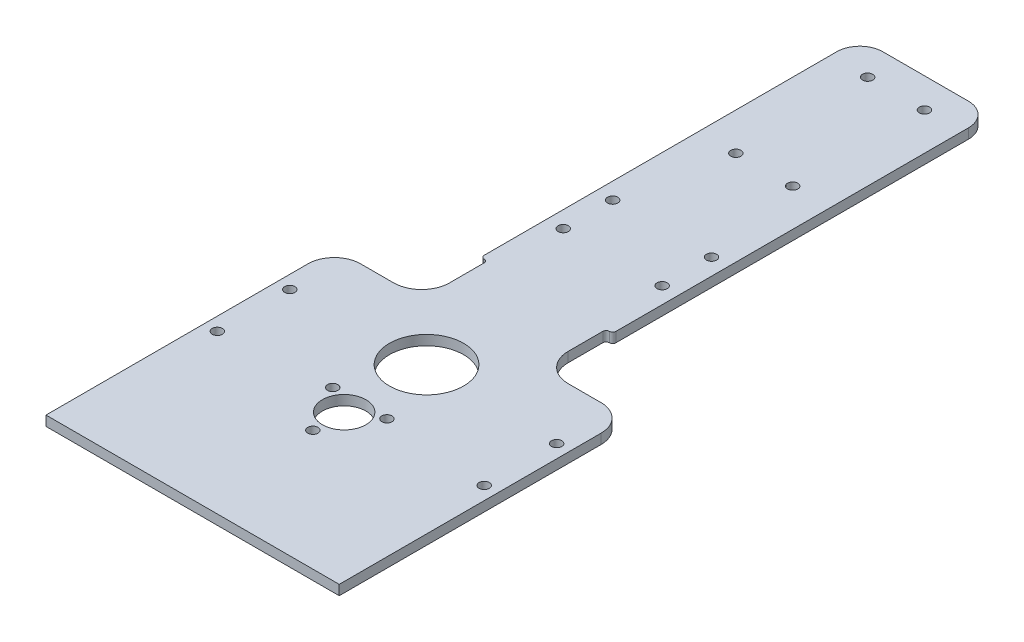
from build123d import *

# Parameters (mm, degrees)
SKETCH_1_W              = 200
SKETCH_1_H              = 200
EXTRUDE_1_DEPTH         = 3
SKETCH_2_R              = 1.5
CUT_EXTRUDE_2_DEPTH     = 10
CUT_EXTRUDE_3_DEPTH     = 10
SKETCH_6_R              = 1.55
CUT_EXTRUDE_3_1_1_DEPTH = 10
CUT_EXTRUDE_6_REACH     = 111.495
SKETCH_11_R             = 1.5
CUT_EXTRUDE_20_5_REACH  = 111.495
SKETCH_4_R              = 11.25
FILLET_1_R              = 1
SKETCH_12_W             = 40
SKETCH_12_H             = 3
EXTRUDE_2_DEPTH         = 75
FILLET_2_R              = 7
SKETCH_13_R             = 1.55
CUT_EXTRUDE_3_1_3_DEPTH = 10
CUT_EXTRUDE_2006_REACH  = 132.367
SKETCH_14_R             = 1.55
SKETCH_14_R_2           = 6.6
FILLET_3_R              = 8
SKETCH_17_R             = 1.55
CUT_EXTRUDE_7_DEPTH     = 131.36679025


with BuildPart() as part:
    # 草图1 → 凸台-拉伸1 (new body)
    with BuildSketch(Plane(origin=(0, 0, 0), x_dir=(1, 0, 0), z_dir=(0, 1, 0))):
        Rectangle(SKETCH_1_W, SKETCH_1_H)
    extrude(amount=EXTRUDE_1_DEPTH)

    # 草图2 → 切除-拉伸2 (cut)
    with BuildSketch(Plane(origin=(0, 3, 0), x_dir=(1, 0, 0), z_dir=(0, 1, 0))):
        with Locations(Location((29.5, 9.5, 0), (0, 0, 270))):
            Circle(SKETCH_2_R)
        with Locations(Location((21.5, 0, 0), (0, 0, 270))):
            Circle(SKETCH_2_R)
        with Locations(Location((29.5, -9.5, 0), (0, 0, 270))):
            Circle(SKETCH_2_R)
        with Locations(Location((37.5, 0, 0), (0, 0, 270))):
            Circle(SKETCH_2_R)
        with Locations(Location((-29.5, -9.5, 0), (0, 0, 270))):
            Circle(SKETCH_2_R)
        with Locations(Location((-37.5, 0, 0), (0, 0, 270))):
            Circle(SKETCH_2_R)
        with Locations(Location((-21.5, 0, 0), (0, 0, 270))):
            Circle(SKETCH_2_R)
        with Locations(Location((-29.5, 9.5, 0), (0, 0, 270))):
            Circle(SKETCH_2_R)
    extrude(amount=-CUT_EXTRUDE_2_DEPTH, mode=Mode.SUBTRACT)

    # 草图5 → 切除-拉伸3 (cut)
    with BuildSketch(Plane(origin=(0, 3, 0), x_dir=(1, 0, 0), z_dir=(0, 1, 0))):
        with BuildLine():
            Line((-100, -100), (-44.5, -100))
            Line((-44.5, -100), (-44.5, 0))
            ThreePointArc((-44.5, 0), (-40.212142643, 10.5), (-29.8, 14.9969997))
            ThreePointArc((-29.8, 14.9969997), (-22.858571571, 17.9949995), (-20, 24.9949995))
            Line((-20, 24.9949995), (-20, 47.5))
            Line((-20, 47.5), (0, 47.5))
            Line((0, 47.5), (20, 47.5))
            Line((20, 47.5), (20, 24.9949995))
            ThreePointArc((20, 24.9949995), (22.858571571, 17.9949995), (29.8, 14.9969997))
            ThreePointArc((29.8, 14.9969997), (40.212142643, 10.5), (44.5, 0))
            Line((44.5, 0), (44.5, -100))
            Line((44.5, -100), (100, -100))
            Line((100, -100), (100, 100))
            Line((100, 100), (-100, 100))
            Line((-100, 100), (-100, -100))
        make_face()
    extrude(amount=-CUT_EXTRUDE_3_DEPTH, mode=Mode.SUBTRACT)

    # 草图6 → φ3.1通孔1 (cut)
    with BuildSketch(Plane.XZ):
        with Locations(Location((-15, -42.5, 0), (0, 0, 270))):
            Circle(SKETCH_6_R)
        with Locations(Location((-15, -27.5, 0), (0, 0, 270))):
            Circle(SKETCH_6_R)
        with Locations(Location((15, -27.5, 0), (0, 0, 90))):
            Circle(SKETCH_6_R)
        with Locations(Location((15, -42.5, 0), (0, 0, 90))):
            Circle(SKETCH_6_R)
    extrude(amount=-CUT_EXTRUDE_3_1_1_DEPTH, mode=Mode.SUBTRACT)

    # 草图11 → 切除-拉伸6 (cut, up to next)
    with BuildSketch(Plane(origin=(0, 3, 0), x_dir=(1, 0, 0), z_dir=(0, 1, 0)), mode=Mode.PRIVATE) as cut_extrude_6_sk1:
        with BuildLine():
            Line((44.5, -17.5), (44.5, -100))
            Line((44.5, -100), (101.133062566, -100))
            Line((101.133062566, -100), (101.133062566, 47.5))
            Line((101.133062566, 47.5), (20, 47.5))
            Line((20, 47.5), (20, 7.5))
            Line((20, 7.5), (19, 7.5))
            ThreePointArc((19, 7.5), (18.292893219, 7.207106781), (18, 6.5))
            Line((18, 6.5), (18, -4))
            ThreePointArc((18, -4), (20.48959236, -10.01040764), (26.5, -12.5))
            Line((26.5, -12.5), (39.5, -12.5))
            Line((39.5, -12.5), (44.5, -12.5))
            Line((44.5, -12.5), (44.5, -17.5))
        make_face()
        with Locations((29.5, -9.5)):
            Circle(SKETCH_11_R, mode=Mode.SUBTRACT)
        with Locations((21.5, 0)):
            Circle(SKETCH_11_R, mode=Mode.SUBTRACT)
    cut_extrude_6_tool1 = extrude(cut_extrude_6_sk1.sketch, amount=-CUT_EXTRUDE_6_REACH, mode=Mode.PRIVATE) & part.part
    # 草图11 → 切除-拉伸6 (cut, up to next)
    with BuildSketch(Plane(origin=(0, 3, 0), x_dir=(1, 0, 0), z_dir=(0, 1, 0)), mode=Mode.PRIVATE) as cut_extrude_6_sk2:
        with BuildLine():
            Line((-44.5, -17.5), (-44.5, -100))
            Line((-44.5, -100), (-101.133062566, -100))
            Line((-101.133062566, -100), (-101.133062566, 47.5))
            Line((-101.133062566, 47.5), (-20, 47.5))
            Line((-20, 47.5), (-20, 7.5))
            Line((-20, 7.5), (-19, 7.5))
            ThreePointArc((-19, 7.5), (-18.292893219, 7.207106781), (-18, 6.5))
            Line((-18, 6.5), (-18, -4))
            ThreePointArc((-18, -4), (-20.48959236, -10.01040764), (-26.5, -12.5))
            Line((-26.5, -12.5), (-39.5, -12.5))
            Line((-39.5, -12.5), (-44.5, -12.5))
            Line((-44.5, -12.5), (-44.5, -17.5))
        make_face()
    cut_extrude_6_tool2 = extrude(cut_extrude_6_sk2.sketch, amount=-CUT_EXTRUDE_6_REACH, mode=Mode.PRIVATE) & part.part
    add(cut_extrude_6_tool1.solids().sort_by_distance((66.686037, 3, 19.669577))[0], mode=Mode.SUBTRACT)
    add(cut_extrude_6_tool2.solids().sort_by_distance((-66.626911, 3, 19.648158))[0], mode=Mode.SUBTRACT)

    # 草图4 → φ20.5落弹孔 (cut, up to next)
    with BuildSketch(Plane(origin=(0, 3, 0), x_dir=(1, 0, 0), z_dir=(0, 1, 0)), mode=Mode.PRIVATE) as cut_extrude_20_5_sk1:
        with Locations(Location((0, -29, 0), (0, 0, 270))):
            Circle(SKETCH_4_R)
    cut_extrude_20_5_tool1 = extrude(cut_extrude_20_5_sk1.sketch, amount=-CUT_EXTRUDE_20_5_REACH, mode=Mode.PRIVATE) & part.part
    add(cut_extrude_20_5_tool1.solids().sort_by_distance((0, 3, 29))[0], mode=Mode.SUBTRACT)

    # 圆角1
    fillet_1_edges = [part.edges().sort_by_distance(p)[0] for p in [
        (-20, 1.5, -7.5),
        (20, 1.5, -7.5),
    ]]
    fillet(fillet_1_edges, radius=FILLET_1_R - 0.0001)  # a hair under: the kernel refuses the full size

    # 草图12 → 凸台-拉伸2 (add)
    with BuildSketch(Plane(origin=(0, 0, -47.5), x_dir=(-1, 0, 0), z_dir=(0, 0, -1))):
        with Locations((0, 1.5)):
            Rectangle(SKETCH_12_W, SKETCH_12_H)
    extrude(amount=EXTRUDE_2_DEPTH)

    # 圆角2
    fillet_2_edges = [part.edges().sort_by_distance(p)[0] for p in [
        (20, 1.5, -122.5),
        (-20, 1.5, -122.5),
    ]]
    fillet(fillet_2_edges, radius=FILLET_2_R)

    # 草图13 → φ3.1通孔3 (cut)
    with BuildSketch(Plane(origin=(0, 3, 0), x_dir=(1, 0, 0), z_dir=(0, 1, 0))):
        with Locations(Location((-8.625, 113.5, 0), (0, 0, 270))):
            Circle(SKETCH_13_R)
        with Locations(Location((8.625, 113.5, 0), (0, 0, 270))):
            Circle(SKETCH_13_R)
        with Locations(Location((8.625, 73.5, 0), (0, 0, 270))):
            Circle(SKETCH_13_R)
        with Locations(Location((-8.625, 73.5, 0), (0, 0, 270))):
            Circle(SKETCH_13_R)
    extrude(amount=-CUT_EXTRUDE_3_1_3_DEPTH, mode=Mode.SUBTRACT)

    # 草图14 → 2006电机固定 (cut, up to next)
    with BuildSketch(Plane(origin=(0, 3, 0), x_dir=(1, 0, 0), z_dir=(0, 1, 0)), mode=Mode.PRIVATE) as cut_extrude_2006_sk1:
        with Locations(Location((0, -63.5, 0), (0, 0, 270))):
            Circle(SKETCH_14_R)
    cut_extrude_2006_tool1 = extrude(cut_extrude_2006_sk1.sketch, amount=-CUT_EXTRUDE_2006_REACH, mode=Mode.PRIVATE) & part.part
    # 草图14 → 2006电机固定 (cut, up to next)
    with BuildSketch(Plane(origin=(0, 3, 0), x_dir=(1, 0, 0), z_dir=(0, 1, 0)), mode=Mode.PRIVATE) as cut_extrude_2006_sk2:
        with Locations(Location((-8.227241336, -49.25, 0), (0, 0, 270))):
            Circle(SKETCH_14_R)
    cut_extrude_2006_tool2 = extrude(cut_extrude_2006_sk2.sketch, amount=-CUT_EXTRUDE_2006_REACH, mode=Mode.PRIVATE) & part.part
    # 草图14 → 2006电机固定 (cut, up to next)
    with BuildSketch(Plane(origin=(0, 3, 0), x_dir=(1, 0, 0), z_dir=(0, 1, 0)), mode=Mode.PRIVATE) as cut_extrude_2006_sk3:
        with Locations(Location((8.227241336, -49.25, 0), (0, 0, 270))):
            Circle(SKETCH_14_R)
    cut_extrude_2006_tool3 = extrude(cut_extrude_2006_sk3.sketch, amount=-CUT_EXTRUDE_2006_REACH, mode=Mode.PRIVATE) & part.part
    # 草图14 → 2006电机固定 (cut, up to next)
    with BuildSketch(Plane(origin=(0, 3, 0), x_dir=(1, 0, 0), z_dir=(0, 1, 0)), mode=Mode.PRIVATE) as cut_extrude_2006_sk4:
        with Locations(Location((0, -54, 0), (0, 0, 270))):
            Circle(SKETCH_14_R_2)
    cut_extrude_2006_tool4 = extrude(cut_extrude_2006_sk4.sketch, amount=-CUT_EXTRUDE_2006_REACH, mode=Mode.PRIVATE) & part.part
    add(cut_extrude_2006_tool1.solids().sort_by_distance((0, 3, 63.5))[0], mode=Mode.SUBTRACT)
    add(cut_extrude_2006_tool2.solids().sort_by_distance((-8.227241, 3, 49.25))[0], mode=Mode.SUBTRACT)
    add(cut_extrude_2006_tool3.solids().sort_by_distance((8.227241, 3, 49.25))[0], mode=Mode.SUBTRACT)
    add(cut_extrude_2006_tool4.solids().sort_by_distance((0, 3, 54))[0], mode=Mode.SUBTRACT)

    # 圆角3
    fillet_3_edges = [part.edges().sort_by_distance(p)[0] for p in [
        (44.5, 1.5, 12.5),
        (-44.5, 1.5, 12.5),
    ]]
    fillet(fillet_3_edges, radius=FILLET_3_R)

    # 草图17 → 切除-拉伸7 (cut, through all)
    with BuildSketch(Plane(origin=(0, 3, 0), x_dir=(1, 0, 0), z_dir=(0, 1, 0))):
        with Locations(Location((-40.5, -30, 0), (0, 0, 270))):
            Circle(SKETCH_17_R)
        with Locations(Location((-40.5, -52, 0), (0, 0, 270))):
            Circle(SKETCH_17_R)
    cut_extrude_7 = extrude(amount=-CUT_EXTRUDE_7_DEPTH, mode=Mode.SUBTRACT)

    # 镜向1: 切除-拉伸7 across plane
    add(cut_extrude_7.mirror(Plane(origin=(0, 0, 0), x_dir=(0, 0, 1), z_dir=(1, 0, 0))), mode=Mode.SUBTRACT)


solid = part.part
